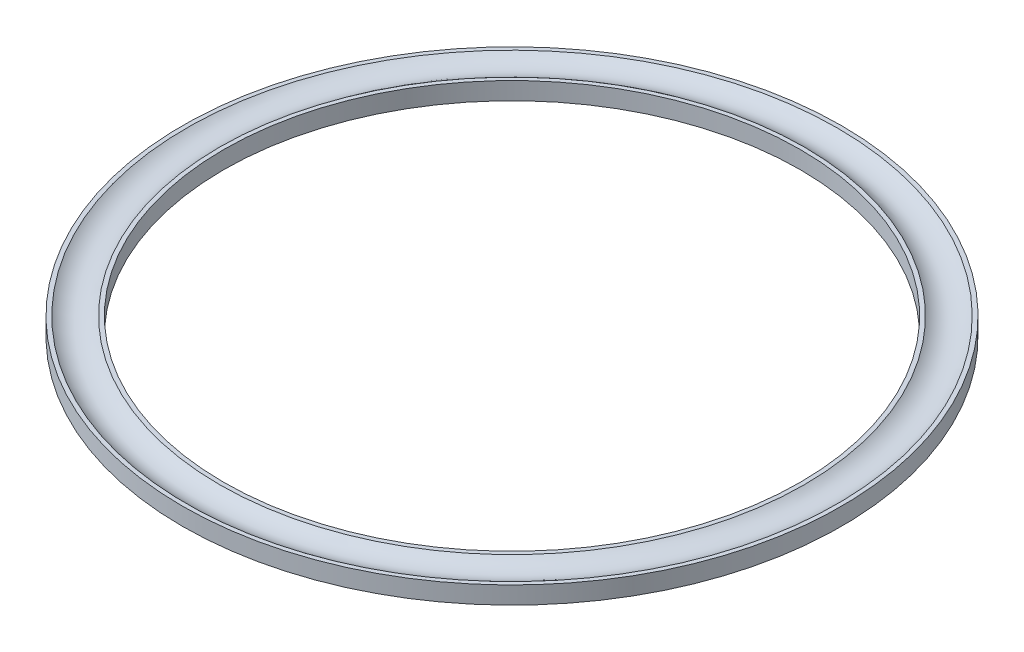
from build123d import *


with BuildPart() as part:
    # Sketch1 → Revolve2 (revolve)
    with BuildSketch(Plane.XY):
        with BuildLine():
            Line((23.9141, -0.635), (23.9141, 0.635))
            Line((23.9141, 0.635), (23.61438, 0.635))
            ThreePointArc((23.61438, 0.635), (22.4155, 0.19304), (21.21662, 0.635))
            Line((21.21662, 0.635), (20.9169, 0.635))
            Line((20.9169, 0.635), (20.9169, -0.635))
            Line((20.9169, -0.635), (23.9141, -0.635))
        make_face()
    revolve(axis=Axis((0, -11.412625366, 0), (0, 1, 0)))


solid = part.part
